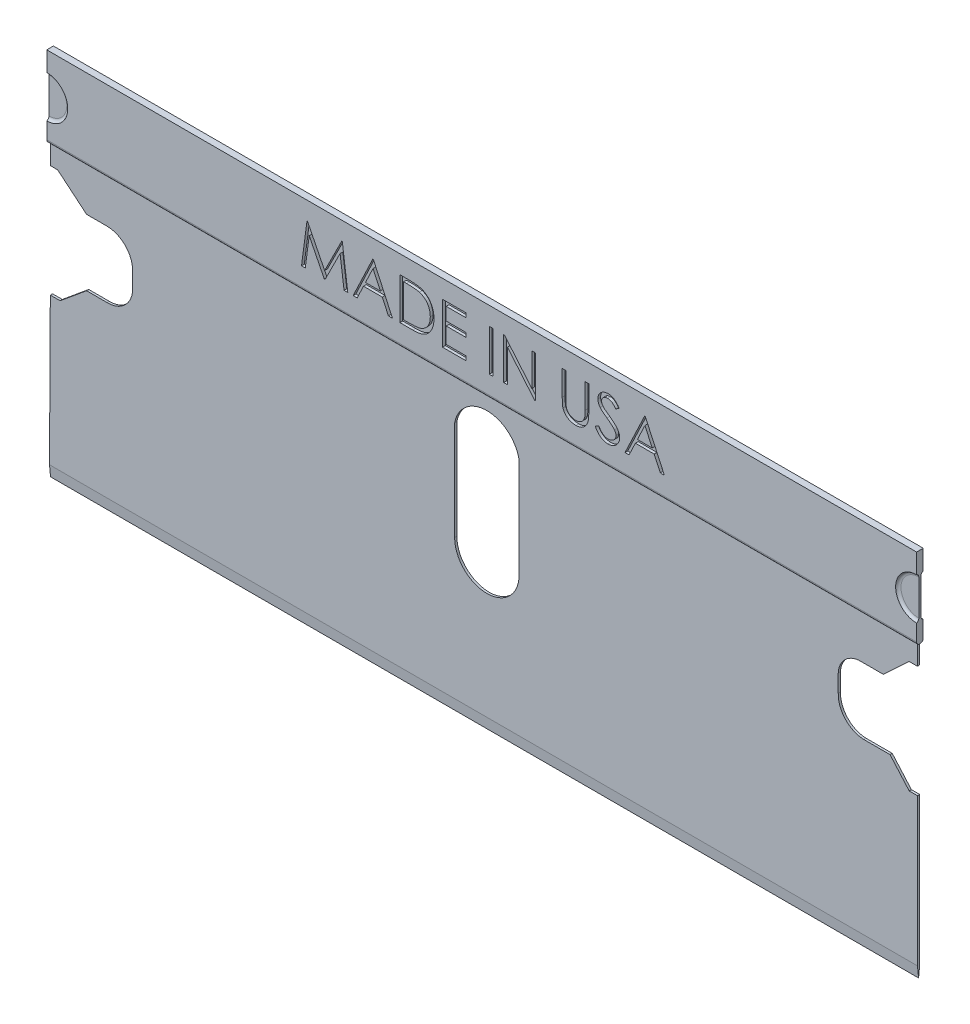
from build123d import *

# Parameters (mm, degrees)
BOSS_EXTRUDE1_DEPTH      = 0.508
BOSS_EXTRUDE1_DEPTH_BACK = 0.508
CHAMFER1_SIZE            = 0.508
CHAMFER1_SIZE2           = 5.08
CHAMFER2_SIZE            = 0.508
CHAMFER2_SIZE_2          = 5.08
BOSS_EXTRUDE2_DEPTH      = 1.016
BOSS_EXTRUDE2_DEPTH_BACK = 2.032
SKETCH2_W                = 399.272431755
SKETCH2_H                = 37.263625027
CUT_EXTRUDE1_DEPTH       = 1.016
FILLET1_R                = 1.524
CUT_EXTRUDE2_DEPTH       = 1.016
FILLET2_R                = 1.524
FILLET3_R                = 1.524
SKETCH5_W                = 1.709615385
SKETCH5_H                = 19.05
CUT_EXTRUDE3_DEPTH       = 1.27


with BuildPart() as part:
    # Sketch1 → Boss-Extrude1 (new, two sides: drawn at the far end of the back side and taken through both)
    with BuildSketch(Plane.XY.offset(-BOSS_EXTRUDE1_DEPTH_BACK)):
        with BuildLine():
            Line((6.643225181, 0), (405.095344745, 0))
            Line((405.095344745, 0), (405.095344745, 72.717463837))
            Line((405.095344745, 72.717463837), (401.301060978, 72.717463837))
            Line((401.301060978, 72.717463837), (392.49166006, 82.756133195))
            Line((392.49166006, 82.756133195), (380.410802322, 82.756133195))
            ThreePointArc((380.410802322, 82.756133195), (371.972618922, 86.601223076), (368.724811349, 95.286808909))
            Line((368.724811349, 95.286808909), (368.724811349, 103.275316273))
            ThreePointArc((368.724811349, 103.275316273), (372.077551467, 110.435017431), (379.51096998, 113.126945398))
            Line((379.51096998, 113.126945398), (389.448720773, 113.126945398))
            Line((389.448720773, 113.126945398), (401.301060978, 124.174896288))
            Line((401.301060978, 124.174896288), (405.095344745, 124.174896288))
            Line((405.095344745, 124.174896288), (405.095344745, 133.946197196))
            Line((405.095344745, 133.946197196), (7.04297701, 133.946197196))
            Line((7.04297701, 133.946197196), (7.04297701, 124.174896288))
            Line((7.04297701, 124.174896288), (10.403963263, 124.174896288))
            Line((10.403963263, 124.174896288), (23.690663617, 113.126945398))
            Line((23.690663617, 113.126945398), (33.017634847, 113.126945398))
            ThreePointArc((33.017634847, 113.126945398), (41.394000015, 109.656176459), (44.860791597, 101.278164368))
            Line((44.860791597, 101.278164368), (44.860791597, 93.928592246))
            ThreePointArc((44.860791597, 93.928592246), (41.253105254, 85.889564647), (33.017634847, 82.756133195))
            Line((33.017634847, 82.756133195), (23.690663617, 82.756133195))
            Line((23.690663617, 82.756133195), (11.539233296, 72.717463837))
            Line((11.539233296, 72.717463837), (7.04297701, 72.717463837))
            Line((7.04297701, 72.717463837), (6.643225181, 0))
        make_face()
        with BuildLine():
            Line((192.64061853, 114.699578164), (192.64061853, 69.101143636))
            ThreePointArc((192.64061853, 69.101143636), (207.448998038, 54.292764127), (222.257377546, 69.101143636))
            Line((222.257377546, 69.101143636), (222.257377546, 114.699578164))
            ThreePointArc((222.257377546, 114.699578164), (207.448998038, 126.994222235), (192.64061853, 114.699578164))
        make_face(mode=Mode.SUBTRACT)
    extrude(amount=BOSS_EXTRUDE1_DEPTH + BOSS_EXTRUDE1_DEPTH_BACK)

    # Chamfer1
    chamfer1_edges = [part.edges().sort_by_distance(p)[0] for p in [
        (205.869284963, 0, 0.508),
    ]]
    chamfer1_side = [part.faces().sort_by_distance(p)[0] for p in [
        (205.869284963, 0, 0),
    ]]
    chamfer(chamfer1_edges, length=CHAMFER1_SIZE, length2=CHAMFER1_SIZE2, reference=chamfer1_side[0])

    # Chamfer2
    # the kernel refuses this chamfer: 5.08, 0.508 mm, written as the material it takes off along each edge
    with BuildSketch(Plane(origin=(-6.562350455, 0, -0.508), x_dir=(0, -0.35748514475784465, 0.9339188247794681), z_dir=(1, 0, 0))) as chamfer2_piece_1:
        Polygon((CHAMFER2_SIZE * 0.933918824779, -CHAMFER2_SIZE * 0.357485144758), (-CHAMFER2_SIZE_2 * 0.357485144758, -CHAMFER2_SIZE_2 * 0.933918824779), (0, 0), align=None)
    extrude(amount=424.863270836, mode=Mode.SUBTRACT)

    # Sketch2 → Boss-Extrude2 (add, two sides: drawn at the far end of the back side and taken through both)
    with BuildSketch(Plane.XY.offset(0.508).offset(-BOSS_EXTRUDE2_DEPTH_BACK)):
        with Locations((206.069160878, 151.771231944)):
            Rectangle(SKETCH2_W, SKETCH2_H)
    extrude(amount=BOSS_EXTRUDE2_DEPTH + BOSS_EXTRUDE2_DEPTH_BACK)

    # Sketch3 → Cut-Extrude1 (cut)
    with BuildSketch(Plane.XY.offset(1.524)):
        with BuildLine():
            Line((405.705376755, 161.390254295), (405.705376755, 142.152209592))
            ThreePointArc((405.705376755, 142.152209592), (396.086354404, 151.771231944), (405.705376755, 161.390254295))
        make_face()
        with BuildLine():
            Line((6.432945, 161.390254295), (6.432945, 142.152209592))
            ThreePointArc((6.432945, 142.152209592), (16.051967351, 151.771231944), (6.432945, 161.390254295))
        make_face()
    extrude(amount=-CUT_EXTRUDE1_DEPTH, mode=Mode.SUBTRACT)

    # Fillet1
    # the kernel refuses this fillet: 1.524 mm, written as the material it adds along each edge
    with BuildSketch(Plane(origin=(6.432945, 151.771231944, 0.508), x_dir=(0, -1, 0), z_dir=(-1, 0, 0))) as fillet1_piece_1:
        with BuildLine():
            CenterArc((8.182181372, 1.524), FILLET1_R, 270, 70.528779366)
            Line((8.182181372, 0), (8.182181372, -0.03048))
            Line((8.182181372, -0.03048), (9.619022351, -0.03048))
            Line((9.619022351, -0.03048), (9.649502351, 0))
            ThreePointArc((9.649502351, 0), (9.649502351, 0.508), (9.647759171, 1.00584))
            Line((9.647759171, 1.00584), (9.619022351, 1.016))
        make_face()
    revolve(axis=Axis((6.432945, 151.771231944, 0.508), (0, 0, 1)), revolution_arc=180)
    with BuildSketch(Plane(origin=(405.705376755, 151.771231944, 0.508), x_dir=(0, -1, 0), z_dir=(1, 0, 0))) as fillet1_piece_2:
        with BuildLine():
            CenterArc((8.182181372, -1.524), FILLET1_R, 19.471220634, 70.528779366)
            Line((8.182181372, 0), (8.182181372, 0.03048))
            Line((8.182181372, 0.03048), (9.619022351, 0.03048))
            Line((9.619022351, 0.03048), (9.649502351, 0))
            ThreePointArc((9.649502351, 0), (9.649502351, -0.508), (9.647759171, -1.00584))
            Line((9.647759171, -1.00584), (9.619022351, -1.016))
        make_face()
    revolve(axis=Axis((405.705376755, 151.771231944, 0.508), (0, 0, -1)), revolution_arc=180)

    # Sketch4 → Cut-Extrude2 (cut)
    with BuildSketch(Plane(origin=(0, 0, -1.524), x_dir=(-1, 0, 0), z_dir=(0, 0, -1))):
        with BuildLine():
            ThreePointArc((-405.705376755, 142.152209592), (-396.086354404, 151.771231944), (-405.705376755, 161.390254295))
            Line((-405.705376755, 161.390254295), (-405.705376755, 142.152209592))
        make_face()
        with BuildLine():
            Line((-6.432945, 142.152209592), (-6.432945, 161.390254295))
            ThreePointArc((-6.432945, 161.390254295), (-16.051967351, 151.771231944), (-6.432945, 142.152209592))
        make_face()
    extrude(amount=-CUT_EXTRUDE2_DEPTH, mode=Mode.SUBTRACT)

    # Fillet2
    # the kernel refuses this fillet: 1.524 mm, written as the material it adds along each edge
    with BuildSketch(Plane(origin=(6.432945, 151.771231944, -0.508), x_dir=(0, 1, 0), z_dir=(-1, 0, 0))) as fillet2_piece_1:
        with BuildLine():
            CenterArc((8.182181372, 1.524), FILLET2_R, 270, 70.528779366)
            Line((8.182181372, 0), (8.182181372, -0.03048))
            Line((8.182181372, -0.03048), (9.619022351, -0.03048))
            Line((9.619022351, -0.03048), (9.649502351, 0))
            ThreePointArc((9.649502351, 0), (9.649502351, 0.508), (9.647759171, 1.00584))
            Line((9.647759171, 1.00584), (9.619022351, 1.016))
        make_face()
    revolve(axis=Axis((6.432945, 151.771231944, -0.508), (0, 0, -1)), revolution_arc=180)
    with BuildSketch(Plane(origin=(405.705376755, 151.771231944, -0.508), x_dir=(0, -1, 0), z_dir=(1, 0, 0))) as fillet2_piece_2:
        with BuildLine():
            CenterArc((8.182181372, 1.524), FILLET2_R, 270, 70.528779366)
            Line((8.182181372, 0), (8.182181372, -0.03048))
            Line((8.182181372, -0.03048), (9.619022351, -0.03048))
            Line((9.619022351, -0.03048), (9.649502351, 0))
            ThreePointArc((9.649502351, 0), (9.649502351, 0.508), (9.647759171, 1.00584))
            Line((9.647759171, 1.00584), (9.619022351, 1.016))
        make_face()
    revolve(axis=Axis((405.705376755, 151.771231944, -0.508), (0, 0, -1)), revolution_arc=180)

    # Fillet3
    # the kernel refuses this fillet: 1.524 mm, written as the material it takes off along each edge
    with BuildSketch(Plane(origin=(2.622945, 133.13941943, 1.524), x_dir=(0, 0, -1), z_dir=(1, 0, 0))) as fillet3_piece_1_section:
        with BuildLine():
            CenterArc((FILLET3_R, FILLET3_R), FILLET3_R, 180, 90)
            Line((0, FILLET3_R), (0, 0))
            Line((0, 0), (FILLET3_R, 0))
        make_face()
    fillet3_piece_1 = extrude(amount=406.892431756, mode=Mode.PRIVATE)
    fillet3_piece_1 = split(fillet3_piece_1, bisect_by=Plane(origin=(7.04297701, 133.144190608, 0.315961517), z_dir=(-1, 0, 0)), keep=Keep.TOP, mode=Mode.PRIVATE)
    fillet3_piece_1 = split(fillet3_piece_1, bisect_by=Plane(origin=(4.832961005, 133.144190608, 0.508), z_dir=(0, 0, -1)), keep=Keep.TOP, mode=Mode.PRIVATE)
    add(fillet3_piece_1, mode=Mode.SUBTRACT)
    with BuildSketch(Plane(origin=(2.622945, 133.13941943, 1.524), x_dir=(0, 0, -1), z_dir=(1, 0, 0))) as fillet3_piece_2_section:
        with BuildLine():
            CenterArc((FILLET3_R, FILLET3_R), FILLET3_R, 180, 90)
            Line((0, FILLET3_R), (0, 0))
            Line((0, 0), (FILLET3_R, 0))
        make_face()
    fillet3_piece_2 = extrude(amount=406.892431756, mode=Mode.PRIVATE)
    fillet3_piece_2 = split(fillet3_piece_2, bisect_by=Plane(origin=(7.04297701, 133.502644665, 1.225133438), z_dir=(-1, 0, 0)), keep=Keep.TOP, mode=Mode.PRIVATE)
    fillet3_piece_2 = split(fillet3_piece_2, bisect_by=Plane(origin=(4.832961005, 133.502644665, 0.508), z_dir=(0, 0, 1)), keep=Keep.TOP, mode=Mode.PRIVATE)
    add(fillet3_piece_2, mode=Mode.SUBTRACT)
    with BuildSketch(Plane(origin=(2.622945, 133.13941943, 1.524), x_dir=(0, 0, -1), z_dir=(1, 0, 0))) as fillet3_piece_3_section:
        with BuildLine():
            CenterArc((FILLET3_R, FILLET3_R), FILLET3_R, 180, 90)
            Line((0, FILLET3_R), (0, 0))
            Line((0, 0), (FILLET3_R, 0))
        make_face()
    fillet3_piece_3 = extrude(amount=406.892431756, mode=Mode.PRIVATE)
    fillet3_piece_3 = split(fillet3_piece_3, bisect_by=Plane(origin=(405.095344745, 133.502644665, 1.225133438), z_dir=(-1, 0, 0)), keep=Keep.TOP, mode=Mode.PRIVATE)
    fillet3_piece_3 = split(fillet3_piece_3, bisect_by=Plane(origin=(7.04297701, 133.502644665, 1.225133438), z_dir=(1, 0, 0)), keep=Keep.TOP, mode=Mode.PRIVATE)
    fillet3_piece_3 = split(fillet3_piece_3, bisect_by=Plane(origin=(206.069160877, 133.502644665, 0.508), z_dir=(0, 0, 1)), keep=Keep.TOP, mode=Mode.PRIVATE)
    add(fillet3_piece_3, mode=Mode.SUBTRACT)
    with BuildSketch(Plane(origin=(2.622945, 133.13941943, 1.524), x_dir=(0, 0, -1), z_dir=(1, 0, 0))) as fillet3_piece_4_section:
        with BuildLine():
            CenterArc((FILLET3_R, FILLET3_R), FILLET3_R, 180, 90)
            Line((0, FILLET3_R), (0, 0))
            Line((0, 0), (FILLET3_R, 0))
        make_face()
    fillet3_piece_4 = extrude(amount=406.892431756, mode=Mode.PRIVATE)
    fillet3_piece_4 = split(fillet3_piece_4, bisect_by=Plane(origin=(405.095344745, 133.144190608, 0.315961517), z_dir=(1, 0, 0)), keep=Keep.TOP, mode=Mode.PRIVATE)
    fillet3_piece_4 = split(fillet3_piece_4, bisect_by=Plane(origin=(407.30536075, 133.144190608, 0.508), z_dir=(0, 0, -1)), keep=Keep.TOP, mode=Mode.PRIVATE)
    add(fillet3_piece_4, mode=Mode.SUBTRACT)
    with BuildSketch(Plane(origin=(2.622945, 133.13941943, 1.524), x_dir=(0, 0, -1), z_dir=(1, 0, 0))) as fillet3_piece_5_section:
        with BuildLine():
            CenterArc((FILLET3_R, FILLET3_R), FILLET3_R, 180, 90)
            Line((0, FILLET3_R), (0, 0))
            Line((0, 0), (FILLET3_R, 0))
        make_face()
    fillet3_piece_5 = extrude(amount=406.892431756, mode=Mode.PRIVATE)
    fillet3_piece_5 = split(fillet3_piece_5, bisect_by=Plane(origin=(405.095344745, 133.502644665, 1.225133438), z_dir=(1, 0, 0)), keep=Keep.TOP, mode=Mode.PRIVATE)
    fillet3_piece_5 = split(fillet3_piece_5, bisect_by=Plane(origin=(407.30536075, 133.502644665, 0.508), z_dir=(0, 0, 1)), keep=Keep.TOP, mode=Mode.PRIVATE)
    add(fillet3_piece_5, mode=Mode.SUBTRACT)
    with BuildSketch(Plane(origin=(2.622945, 133.13941943, -1.524), x_dir=(0, 1, 0), z_dir=(1, 0, 0))) as fillet3_piece_6_section:
        with BuildLine():
            CenterArc((FILLET3_R, FILLET3_R), FILLET3_R, 180, 90)
            Line((0, FILLET3_R), (0, 0))
            Line((0, 0), (FILLET3_R, 0))
        make_face()
    fillet3_piece_6 = extrude(amount=406.892431756, mode=Mode.PRIVATE)
    fillet3_piece_6 = split(fillet3_piece_6, bisect_by=Plane(origin=(4.832961005, 133.502644665, -0.508), z_dir=(0, 0, -1)), keep=Keep.TOP, mode=Mode.PRIVATE)
    fillet3_piece_6 = split(fillet3_piece_6, bisect_by=Plane(origin=(7.04297701, 133.502644665, -1.225133438), z_dir=(-1, 0, 0)), keep=Keep.TOP, mode=Mode.PRIVATE)
    add(fillet3_piece_6, mode=Mode.SUBTRACT)
    with BuildSketch(Plane(origin=(2.622945, 133.13941943, -1.524), x_dir=(0, 1, 0), z_dir=(1, 0, 0))) as fillet3_piece_7_section:
        with BuildLine():
            CenterArc((FILLET3_R, FILLET3_R), FILLET3_R, 180, 90)
            Line((0, FILLET3_R), (0, 0))
            Line((0, 0), (FILLET3_R, 0))
        make_face()
    fillet3_piece_7 = extrude(amount=406.892431756, mode=Mode.PRIVATE)
    fillet3_piece_7 = split(fillet3_piece_7, bisect_by=Plane(origin=(4.832961005, 133.144190608, -0.508), z_dir=(0, 0, 1)), keep=Keep.TOP, mode=Mode.PRIVATE)
    fillet3_piece_7 = split(fillet3_piece_7, bisect_by=Plane(origin=(7.04297701, 133.144190608, -0.315961517), z_dir=(-1, 0, 0)), keep=Keep.TOP, mode=Mode.PRIVATE)
    add(fillet3_piece_7, mode=Mode.SUBTRACT)
    with BuildSketch(Plane(origin=(2.622945, 133.13941943, -1.524), x_dir=(0, 1, 0), z_dir=(1, 0, 0))) as fillet3_piece_8_section:
        with BuildLine():
            CenterArc((FILLET3_R, FILLET3_R), FILLET3_R, 180, 90)
            Line((0, FILLET3_R), (0, 0))
            Line((0, 0), (FILLET3_R, 0))
        make_face()
    fillet3_piece_8 = extrude(amount=406.892431756, mode=Mode.PRIVATE)
    fillet3_piece_8 = split(fillet3_piece_8, bisect_by=Plane(origin=(405.095344745, 133.502644665, -1.225133438), z_dir=(-1, 0, 0)), keep=Keep.TOP, mode=Mode.PRIVATE)
    fillet3_piece_8 = split(fillet3_piece_8, bisect_by=Plane(origin=(206.069160877, 133.502644665, -0.508), z_dir=(0, 0, -1)), keep=Keep.TOP, mode=Mode.PRIVATE)
    fillet3_piece_8 = split(fillet3_piece_8, bisect_by=Plane(origin=(7.04297701, 133.502644665, -1.225133438), z_dir=(1, 0, 0)), keep=Keep.TOP, mode=Mode.PRIVATE)
    add(fillet3_piece_8, mode=Mode.SUBTRACT)
    with BuildSketch(Plane(origin=(2.622945, 133.13941943, -1.524), x_dir=(0, 1, 0), z_dir=(1, 0, 0))) as fillet3_piece_9_section:
        with BuildLine():
            CenterArc((FILLET3_R, FILLET3_R), FILLET3_R, 180, 90)
            Line((0, FILLET3_R), (0, 0))
            Line((0, 0), (FILLET3_R, 0))
        make_face()
    fillet3_piece_9 = extrude(amount=406.892431756, mode=Mode.PRIVATE)
    fillet3_piece_9 = split(fillet3_piece_9, bisect_by=Plane(origin=(405.095344745, 133.502644665, -1.225133438), z_dir=(1, 0, 0)), keep=Keep.TOP, mode=Mode.PRIVATE)
    fillet3_piece_9 = split(fillet3_piece_9, bisect_by=Plane(origin=(407.30536075, 133.502644665, -0.508), z_dir=(0, 0, -1)), keep=Keep.TOP, mode=Mode.PRIVATE)
    add(fillet3_piece_9, mode=Mode.SUBTRACT)
    with BuildSketch(Plane(origin=(2.622945, 133.13941943, -1.524), x_dir=(0, 1, 0), z_dir=(1, 0, 0))) as fillet3_piece_10_section:
        with BuildLine():
            CenterArc((FILLET3_R, FILLET3_R), FILLET3_R, 180, 90)
            Line((0, FILLET3_R), (0, 0))
            Line((0, 0), (FILLET3_R, 0))
        make_face()
    fillet3_piece_10 = extrude(amount=406.892431756, mode=Mode.PRIVATE)
    fillet3_piece_10 = split(fillet3_piece_10, bisect_by=Plane(origin=(405.095344745, 133.144190608, -0.315961517), z_dir=(1, 0, 0)), keep=Keep.TOP, mode=Mode.PRIVATE)
    fillet3_piece_10 = split(fillet3_piece_10, bisect_by=Plane(origin=(407.30536075, 133.144190608, -0.508), z_dir=(0, 0, 1)), keep=Keep.TOP, mode=Mode.PRIVATE)
    add(fillet3_piece_10, mode=Mode.SUBTRACT)

    # Sketch5 → Cut-Extrude3 (cut)
    # profile 1 of 9: a face of its own
    with BuildSketch(Plane.XY.offset(1.524)):
        Polygon((123.365110877, 143.022992377), (125.879924579, 162.072992377), (126.124155348, 162.072992377), (133.989149338, 146.442223146), (141.8350628, 162.072992377), (142.083109675, 162.072992377), (144.6131878, 143.022992377), (142.895940204, 143.022992377), (141.071841646, 156.7304443), (134.19521905, 143.022992377), (133.809792367, 143.022992377), (126.906457031, 156.760973146), (125.086174579, 143.022992377), align=None)
    # profile 2 of 9: a face of its own
    with BuildSketch(Plane.XY.offset(1.524)):
        Polygon((156.336264723, 162.072992377), (165.128572415, 143.022992377), (163.270128906, 143.022992377), (160.453842848, 149.128761608), (151.817995492, 149.128761608), (148.921571213, 143.022992377), (147.055495492, 143.022992377), (156.092033954, 162.072992377), align=None)
        Polygon((156.195068809, 158.359921464), (152.745309194, 151.082607762), (159.553241886, 151.082607762), align=None, mode=Mode.SUBTRACT)
    # profile 3 of 9: a face of its own
    with BuildSketch(Plane.XY.offset(1.524)):
        with BuildLine():
            Line((168.547803184, 143.022992377), (168.547803184, 162.072992377))
            Line((168.547803184, 162.072992377), (172.3944378, 162.072992377))
            add(Edge.make_bspline(
                [(172.3944378, 162.072992377), (172.729004721, 162.070583532), (173.375386273, 162.065929655), (174.309448308, 162.036421798), (175.173685644, 161.984222262), (175.96525592, 161.908188127), (176.686332231, 161.814826616), (177.334895512, 161.697802986), (177.914299318, 161.559618802), (178.270640131, 161.441805708), (178.439149338, 161.386093339)],
                knots=[0, 0, 0, 0, 1.314313732, 2.53924729, 3.670748893, 4.714932338, 5.66265055, 6.526160246, 7.303039223, 8, 8, 8, 8], degree=3))
            add(Edge.make_bspline(
                [(178.439149338, 161.386093339), (178.659556419, 161.302106212), (179.09537248, 161.136036509), (179.715896962, 160.822765783), (180.30005358, 160.467820186), (180.850974926, 160.070731848), (181.356076567, 159.620257323), (181.835090976, 159.135532328), (182.268422544, 158.598930076), (182.665251984, 158.02157907), (183.023041787, 157.410280615), (183.334042061, 156.766199523), (183.592327368, 156.092606719), (183.806739072, 155.391375414), (183.975720506, 154.6609637), (184.091010734, 153.900521086), (184.167052836, 153.113052927), (184.174694887, 152.578703346), (184.178572415, 152.307577714)],
                knots=[0, 0, 0, 0, 0.984719456, 1.947108742, 2.898477687, 3.838006223, 4.779231079, 5.722358779, 6.681677486, 7.655904652, 8.64651281, 9.637519902, 10.640069247, 11.656948941, 12.698408672, 13.768548281, 14.867775369, 16, 16, 16, 16], degree=3))
            add(Edge.make_bspline(
                [(184.178572415, 152.307577714), (184.175149035, 152.072112973), (184.168402907, 151.608105107), (184.107827631, 150.924259661), (184.019782231, 150.260701508), (183.88347024, 149.620590484), (183.717993703, 148.998318327), (183.505917394, 148.400517111), (183.262972765, 147.821702949), (182.979672711, 147.269702116), (182.668660316, 146.746734046), (182.334894828, 146.253744386), (181.978732243, 145.797767822), (181.596776298, 145.377423519), (181.19396287, 144.993345156), (180.767654728, 144.64232433), (180.316751837, 144.331229367), (179.84327376, 144.047835535), (179.333407972, 143.800619029), (178.777497043, 143.591449976), (178.173170202, 143.418113398), (177.521910808, 143.273491808), (176.822593594, 143.15877106), (176.074532937, 143.081883124), (175.278878175, 143.029887876), (174.732528174, 143.025335507), (174.451318809, 143.022992377)],
                knots=[0, 0, 0, 0, 1.105936401, 2.179363191, 3.223086493, 4.248585256, 5.251745608, 6.245858792, 7.225916811, 8.198733463, 9.158002045, 10.082870192, 10.993790845, 11.873723703, 12.748670949, 13.606408763, 14.465103618, 15.319838547, 16.196477973, 17.123216899, 18.106603292, 19.147568657, 20.255746949, 21.433717677, 22.679120308, 24, 24, 24, 24], degree=3))
            Line((174.451318809, 143.022992377), (168.547803184, 143.022992377))
        make_face()
        with BuildLine():
            Line((170.257418569, 144.976838531), (172.444047175, 144.976838531))
            add(Edge.make_bspline(
                [(172.444047175, 144.976838531), (172.75825445, 144.978188884), (173.36259011, 144.980786108), (174.231585781, 145.003576456), (175.025586496, 145.040816145), (175.744704997, 145.092931925), (176.388535258, 145.161885388), (176.958422811, 145.238765216), (177.452499574, 145.334545626), (177.751472652, 145.42136442), (177.889630108, 145.461483964)],
                knots=[0, 0, 0, 0, 1.375205317, 2.645023457, 3.804390687, 4.853969522, 5.800190428, 6.637939096, 7.370582563, 8, 8, 8, 8], degree=3))
            add(Edge.make_bspline(
                [(177.889630108, 145.461483964), (178.063520478, 145.522724588), (178.407147852, 145.643743105), (178.901800616, 145.864492661), (179.363120884, 146.125978783), (179.799148307, 146.416639732), (180.203697675, 146.746727257), (180.581563222, 147.109063639), (180.931984169, 147.505492915), (181.251340046, 147.935523051), (181.537135243, 148.39647751), (181.784628649, 148.883824591), (182.001534842, 149.392224515), (182.171779754, 149.929484364), (182.305214576, 150.490801096), (182.399728092, 151.0762142), (182.458591092, 151.685614348), (182.465456973, 152.100099482), (182.468957031, 152.311393819)],
                knots=[0, 0, 0, 0, 0.998632004, 1.973411704, 2.929992603, 3.868527914, 4.809262121, 5.754881198, 6.702106254, 7.672490631, 8.653608572, 9.636854334, 10.631411391, 11.644891563, 12.686317036, 13.754757253, 14.855430412, 16, 16, 16, 16], degree=3))
            add(Edge.make_bspline(
                [(182.468957031, 152.311393819), (182.466163281, 152.534188905), (182.460674935, 152.971871823), (182.391690474, 153.614078321), (182.290880293, 154.231737291), (182.145100516, 154.82489004), (181.959331018, 155.394693785), (181.727494468, 155.937997119), (181.462609012, 156.460537906), (181.147449421, 156.950255525), (180.802287406, 157.413405162), (180.419230663, 157.837702631), (180.004364996, 158.224114465), (179.562215315, 158.578658438), (179.080320532, 158.887070731), (178.570032587, 159.162951096), (178.023865434, 159.397080447), (177.643884903, 159.521606829), (177.450777944, 159.584891416)],
                knots=[0, 0, 0, 0, 1.122418816, 2.205001699, 3.251619955, 4.274784885, 5.280384055, 6.268708349, 7.249350384, 8.229342522, 9.199999885, 10.157847722, 11.105861043, 12.055065948, 13.010012805, 13.98527497, 14.976112212, 16, 16, 16, 16], degree=3))
            add(Edge.make_bspline(
                [(177.450777944, 159.584891416), (177.291023847, 159.629067973), (176.951342806, 159.722999455), (176.397045152, 159.825463268), (175.773211267, 159.915839184), (175.077071465, 159.992355084), (174.309419281, 160.047258933), (173.469664322, 160.088468517), (172.557443617, 160.116263188), (171.925078683, 160.118161151), (171.596871694, 160.119146223)],
                knots=[0, 0, 0, 0, 0.674548936, 1.434276114, 2.292660221, 3.240891867, 4.284742987, 5.42552168, 6.663806718, 8, 8, 8, 8], degree=3))
            Line((171.596871694, 160.119146223), (170.257418569, 160.119146223))
            Line((170.257418569, 160.119146223), (170.257418569, 144.976838531))
        make_face(mode=Mode.SUBTRACT)
    # profile 4 of 9: a face of its own
    with BuildSketch(Plane.XY.offset(1.524)):
        Polygon((188.086264723, 162.072992377), (198.832418569, 162.072992377), (198.832418569, 160.119146223), (189.795880108, 160.119146223), (189.795880108, 154.257607762), (198.832418569, 154.257607762), (198.832418569, 152.303761608), (189.795880108, 152.303761608), (189.795880108, 144.976838531), (198.832418569, 144.976838531), (198.832418569, 143.022992377), (188.086264723, 143.022992377), align=None)
    # profile 5 of 9: a face of its own
    with BuildSketch(Plane.XY.offset(1.524)):
        with Locations((210.433380107, 152.547992377)):
            Rectangle(SKETCH5_W, SKETCH5_H)
    # profile 6 of 9: a face of its own
    with BuildSketch(Plane.XY.offset(1.524)):
        Polygon((216.172803184, 143.022992377), (216.172803184, 162.072992377), (216.531517127, 162.072992377), (229.117033954, 147.07951281), (229.117033954, 162.072992377), (230.826649338, 162.072992377), (230.826649338, 143.022992377), (230.43740655, 143.022992377), (217.882418569, 157.982126992), (217.882418569, 143.022992377), align=None)
    # profile 7 of 9: a face of its own
    with BuildSketch(Plane.XY.offset(1.524)):
        with BuildLine():
            Line((243.0381878, 162.072992377), (244.747803184, 162.072992377))
            Line((244.747803184, 162.072992377), (244.747803184, 150.659020021))
            add(Edge.make_bspline(
                [(244.747803184, 150.659020021), (244.747548764, 150.497472017), (244.747065956, 150.190906839), (244.750290925, 149.754562231), (244.75932263, 149.366636419), (244.765016727, 149.025634084), (244.777684071, 148.733119987), (244.788014869, 148.487509368), (244.801298471, 148.289965208), (244.81726301, 148.174680454), (244.8241253, 148.125125791)],
                knots=[0, 0, 0, 0, 1.528628734, 2.90083645, 4.128790002, 5.200304208, 6.127813768, 6.898992206, 7.526736466, 8, 8, 8, 8], degree=3))
            add(Edge.make_bspline(
                [(244.8241253, 148.125125791), (244.852305468, 147.94634555), (244.907077954, 147.598858696), (245.046667525, 147.104057905), (245.241617066, 146.658116682), (245.472628484, 146.247119511), (245.777061697, 145.882505995), (246.141752368, 145.546618284), (246.583591365, 145.252857462), (247.074866947, 144.984248043), (247.604376597, 144.768356667), (248.145457918, 144.605107069), (248.689977562, 144.505617629), (249.054519261, 144.49409761), (249.235543569, 144.488376992)],
                knots=[0, 0, 0, 0, 1.035780045, 2.013197591, 2.933192213, 3.817615948, 4.702609284, 5.640816605, 6.646850145, 7.73207398, 8.84249596, 9.914020372, 10.964143139, 12, 12, 12, 12], degree=3))
            add(Edge.make_bspline(
                [(249.235543569, 144.488376992), (249.390957499, 144.494221806), (249.700887729, 144.505877675), (250.161388444, 144.57805775), (250.609880464, 144.708145115), (251.048578451, 144.876001514), (251.459791666, 145.097784831), (251.843749543, 145.353984686), (252.186453242, 145.654489597), (252.499188916, 145.987050044), (252.771521924, 146.362279526), (253.007584852, 146.772007678), (253.200947412, 147.222400551), (253.296434311, 147.538926764), (253.345489483, 147.70153805)],
                knots=[0, 0, 0, 0, 0.994687771, 1.983630487, 2.973142513, 3.978332533, 4.983357753, 5.956394766, 6.925816176, 7.893390482, 8.871859704, 9.88551698, 10.913711441, 12, 12, 12, 12], degree=3))
            add(Edge.make_bspline(
                [(253.345489483, 147.70153805), (253.361818736, 147.768749576), (253.398206893, 147.918523942), (253.432208667, 148.171732681), (253.467622755, 148.470487648), (253.492194914, 148.816935372), (253.516150128, 149.209914951), (253.530481567, 149.651473581), (253.537105704, 150.140007896), (253.539079721, 150.48093302), (253.540110877, 150.659020021)],
                knots=[0, 0, 0, 0, 0.558680831, 1.244966039, 2.062412453, 2.990489873, 4.051219941, 5.244515665, 6.560634259, 8, 8, 8, 8], degree=3))
            Line((253.540110877, 150.659020021), (253.540110877, 162.072992377))
            Line((253.540110877, 162.072992377), (255.249726261, 162.072992377))
            Line((255.249726261, 162.072992377), (255.249726261, 150.567433483))
            add(Edge.make_bspline(
                [(255.249726261, 150.567433483), (255.24834312, 150.360069449), (255.245643837, 149.955385929), (255.222236413, 149.362379246), (255.184914743, 148.799843734), (255.132183864, 148.267703774), (255.062313889, 147.767863564), (254.984615903, 147.295941898), (254.885667302, 146.855326323), (254.770096933, 146.442581307), (254.637979479, 146.04968587), (254.4668498, 145.676803267), (254.274039307, 145.312597749), (254.045359554, 144.962577899), (253.788394742, 144.625193946), (253.49746488, 144.302491981), (253.182191947, 143.989315172), (252.837334916, 143.693696911), (252.468578485, 143.422595399), (252.077019573, 143.184210388), (251.665666012, 142.982696127), (251.235587082, 142.816820024), (250.78659925, 142.692099134), (250.318691192, 142.5991615), (249.830797868, 142.546353281), (249.498975954, 142.538505062), (249.330946213, 142.534530839)],
                knots=[0, 0, 0, 0, 1.316592851, 2.569410997, 3.76748051, 4.895814652, 5.963796859, 6.97159953, 7.931736103, 8.829262218, 9.692595152, 10.560224239, 11.431080259, 12.30701507, 13.211635791, 14.121146779, 15.063487852, 16.031507147, 17.00238618, 17.966455255, 18.938106653, 19.907068911, 20.888905087, 21.893141452, 22.933117798, 24, 24, 24, 24], degree=3))
            add(Edge.make_bspline(
                [(249.330946213, 142.534530839), (249.147690098, 142.538802204), (248.788142254, 142.547182607), (248.25834506, 142.595203576), (247.75044922, 142.685655122), (247.259090518, 142.800825673), (246.790958555, 142.959668586), (246.339781379, 143.145259808), (245.913286272, 143.373191753), (245.504554214, 143.626792935), (245.124508042, 143.912132752), (244.775635033, 144.223138556), (244.457359223, 144.554828324), (244.175045319, 144.910793172), (243.924015933, 145.288264606), (243.707770057, 145.688310468), (243.522096543, 146.110775875), (243.426266513, 146.404435437), (243.377821213, 146.552890214)],
                knots=[0, 0, 0, 0, 1.13879206, 2.234305948, 3.301075583, 4.341971843, 5.366689343, 6.369221514, 7.369726634, 8.367512178, 9.355451585, 10.318319045, 11.268648973, 12.207971039, 13.137398894, 14.081662264, 15.030215811, 16, 16, 16, 16], degree=3))
            add(Edge.make_bspline(
                [(243.377821213, 146.552890214), (243.349642681, 146.654304655), (243.288522817, 146.874274835), (243.22307084, 147.238328437), (243.168048552, 147.657509632), (243.116311157, 148.131847112), (243.0857824, 148.661708529), (243.059017484, 149.2468642), (243.037999244, 149.888021677), (243.038123191, 150.334632683), (243.0381878, 150.567433483)],
                knots=[0, 0, 0, 0, 0.625038921, 1.35572334, 2.194682327, 3.136881307, 4.189498639, 5.346923369, 6.617055217, 8, 8, 8, 8], degree=3))
            Line((243.0381878, 150.567433483), (243.0381878, 162.072992377))
        make_face()
    # profile 8 of 9: a face of its own
    with BuildSketch(Plane.XY.offset(1.524)):
        with BuildLine():
            Line((258.180495492, 146.697902233), (259.790892127, 147.663376992))
            add(Edge.make_bspline(
                [(259.790892127, 147.663376992), (259.940669961, 147.412655126), (260.227638511, 146.932281705), (260.706345195, 146.283177228), (261.202368611, 145.731477489), (261.719381984, 145.280391953), (262.254229501, 144.925251584), (262.810402708, 144.673779437), (263.386027364, 144.5169382), (263.777770592, 144.497887729), (263.97334405, 144.488376992)],
                knots=[0, 0, 0, 0, 1.272034388, 2.437168799, 3.508375237, 4.49857839, 5.41946034, 6.295179144, 7.148887113, 8, 8, 8, 8], degree=3))
            add(Edge.make_bspline(
                [(263.97334405, 144.488376992), (264.140368248, 144.493028853), (264.471494112, 144.502251177), (264.958968606, 144.590865257), (265.43239813, 144.727002701), (265.882025144, 144.921970914), (266.30164556, 145.157856101), (266.669619145, 145.442768867), (266.987732989, 145.761754072), (267.24795117, 146.117622521), (267.447595362, 146.500348716), (267.601040763, 146.893192108), (267.686194664, 147.302323887), (267.699022136, 147.577789406), (267.705495492, 147.716802473)],
                knots=[0, 0, 0, 0, 1.095163259, 2.171163733, 3.241058638, 4.321873601, 5.38011039, 6.391990106, 7.366004449, 8.327778327, 9.272591725, 10.192022065, 11.087607919, 12, 12, 12, 12], degree=3))
            add(Edge.make_bspline(
                [(267.705495492, 147.716802473), (267.69747103, 147.875411955), (267.68115847, 148.197841855), (267.543282843, 148.67354568), (267.326389085, 149.144312383), (267.126295267, 149.435512128), (267.022412559, 149.5866943)],
                knots=[0, 0, 0, 0, 0.938893495, 1.908633276, 2.914225137, 4, 4, 4, 4], degree=3))
            add(Edge.make_bspline(
                [(267.022412559, 149.5866943), (266.937119645, 149.695806297), (266.75805784, 149.924873287), (266.450223379, 150.265842354), (266.0890021, 150.617551177), (265.686755608, 150.993429758), (265.228831224, 151.375996195), (264.729571468, 151.783493536), (264.176229607, 152.200424977), (263.788156632, 152.480038512), (263.587917367, 152.624314492)],
                knots=[0, 0, 0, 0, 0.722233717, 1.516239348, 2.393582979, 3.351407094, 4.387010283, 5.505090956, 6.712668013, 8, 8, 8, 8], degree=3))
            add(Edge.make_bspline(
                [(263.587917367, 152.624314492), (263.387489616, 152.767072948), (263.00428702, 153.040016244), (262.468391021, 153.44509699), (261.989177587, 153.815450051), (261.568776654, 154.154561888), (261.207373134, 154.462478494), (260.90211914, 154.736242991), (260.660790708, 154.98325923), (260.526593905, 155.143504247), (260.466342848, 155.21545031)],
                knots=[0, 0, 0, 0, 1.452282411, 2.77665338, 3.964542531, 5.026858415, 5.96415736, 6.766646006, 7.446254459, 8, 8, 8, 8], degree=3))
            add(Edge.make_bspline(
                [(260.466342848, 155.21545031), (260.382127995, 155.32757881), (260.216508183, 155.548094555), (259.997890354, 155.89276271), (259.812075767, 156.245586483), (259.666412217, 156.607513974), (259.543750797, 156.973464087), (259.461248346, 157.348211582), (259.409588028, 157.730074919), (259.404297644, 157.987051258), (259.401649338, 158.115690694)],
                knots=[0, 0, 0, 0, 1.068054152, 2.10047183, 3.106115577, 4.101338837, 5.06977816, 6.043150881, 7.020423561, 8, 8, 8, 8], degree=3))
            add(Edge.make_bspline(
                [(259.401649338, 158.115690694), (259.408753404, 158.317238467), (259.422809692, 158.716026071), (259.541684508, 159.298579591), (259.729315543, 159.854765662), (259.992177718, 160.379077907), (260.331035596, 160.857864175), (260.723171543, 161.296631868), (261.190231203, 161.66548658), (261.702690481, 161.987769355), (262.263611592, 162.240023605), (262.851390652, 162.430311225), (263.466961859, 162.538130185), (263.883901777, 162.553602949), (264.095459434, 162.561453916)],
                knots=[0, 0, 0, 0, 1.005424448, 1.989358655, 2.955360095, 3.929531133, 4.905563448, 5.876582895, 6.856512386, 7.866279853, 8.892233794, 9.918561126, 10.94386622, 12, 12, 12, 12], degree=3))
            add(Edge.make_bspline(
                [(264.095459434, 162.561453916), (264.31994518, 162.55371117), (264.766375681, 162.538313322), (265.423052125, 162.404432473), (266.05529831, 162.18290453), (266.563896652, 161.931506263), (266.961947825, 161.680419558), (267.265510841, 161.451711657), (267.573127252, 161.188412852), (267.887278379, 160.889821812), (268.202641111, 160.553198781), (268.52389733, 160.180849175), (268.851798279, 159.775048492), (269.062740889, 159.485355138), (269.170880108, 159.336844541)],
                knots=[0, 0, 0, 0, 1.286793592, 2.559021753, 3.825965368, 5.121522368, 5.803751409, 6.523245864, 7.299691795, 8.125521123, 9.008227632, 9.944561021, 10.946284179, 12, 12, 12, 12], degree=3))
            Line((269.170880108, 159.336844541), (267.625357271, 158.165300069))
            add(Edge.make_bspline(
                [(267.625357271, 158.165300069), (267.53203441, 158.285525656), (267.352316399, 158.517052026), (267.079468764, 158.841290186), (266.822301123, 159.137471311), (266.568933947, 159.39472865), (266.33274861, 159.627150262), (266.103511566, 159.826139795), (265.88452174, 159.993646965), (265.60847684, 160.17240977), (265.261670402, 160.349610167), (264.826325998, 160.499555864), (264.371377843, 160.589662701), (264.061517992, 160.601576503), (263.904654146, 160.607607762)],
                knots=[0, 0, 0, 0, 1.181633172, 2.275549214, 3.290209073, 4.226197932, 5.078386478, 5.862611352, 6.581680152, 7.217281963, 8.414376989, 9.595101626, 10.782541182, 12, 12, 12, 12], degree=3))
            add(Edge.make_bspline(
                [(263.904654146, 160.607607762), (263.70785936, 160.601012652), (263.328359153, 160.588294604), (262.789569439, 160.44939297), (262.304643933, 160.230688845), (261.887979257, 159.924174464), (261.541067997, 159.561021632), (261.290122571, 159.143125292), (261.13908239, 158.681666787), (261.120651353, 158.3597672), (261.111264723, 158.195828916)],
                knots=[0, 0, 0, 0, 1.14458467, 2.207223713, 3.21896685, 4.227309161, 5.202851033, 6.127160689, 7.046193047, 8, 8, 8, 8], degree=3))
            add(Edge.make_bspline(
                [(261.111264723, 158.195828916), (261.113404455, 158.093767297), (261.117687418, 157.889477168), (261.177421674, 157.587663), (261.254162307, 157.286611281), (261.37577006, 156.987675509), (261.543656641, 156.68562764), (261.764120527, 156.375266469), (262.041778697, 156.053856454), (262.254469293, 155.844810606), (262.366763521, 155.734440694)],
                knots=[0, 0, 0, 0, 0.858281714, 1.717966888, 2.583508476, 3.4729293, 4.427298488, 5.488583878, 6.674047936, 8, 8, 8, 8], degree=3))
            add(Edge.make_bspline(
                [(262.366763521, 155.734440694), (262.408463277, 155.69722774), (262.50753235, 155.608818277), (262.688648461, 155.464080292), (262.927822834, 155.285539489), (263.218809957, 155.064628524), (263.566975169, 154.808370851), (263.972356753, 154.520043048), (264.430435953, 154.19028505), (264.75549381, 153.959739007), (264.927370492, 153.837836127)],
                knots=[0, 0, 0, 0, 0.420754252, 0.999615792, 1.744751191, 2.668019286, 3.750313428, 4.999500688, 6.413464383, 8, 8, 8, 8], degree=3))
            add(Edge.make_bspline(
                [(264.927370492, 153.837836127), (265.134122392, 153.687388156), (265.53446879, 153.396066511), (266.104105046, 152.958375453), (266.620598488, 152.530306884), (267.085762496, 152.114594479), (267.504192526, 151.714391573), (267.871246405, 151.324883406), (268.19066418, 150.948860503), (268.53453964, 150.466772627), (268.88591863, 149.874692725), (269.187678834, 149.149278313), (269.377952125, 148.421044054), (269.402834231, 147.93158513), (269.415110877, 147.690089733)],
                knots=[0, 0, 0, 0, 1.163667725, 2.253281268, 3.268753668, 4.215851969, 5.092017293, 5.902905408, 6.650798638, 7.335211899, 8.59617414, 9.77448103, 10.901945474, 12, 12, 12, 12], degree=3))
            add(Edge.make_bspline(
                [(269.415110877, 147.690089733), (269.411534168, 147.519301774), (269.404450207, 147.181042444), (269.323020091, 146.684354097), (269.203714485, 146.201948935), (269.02389754, 145.73978988), (268.80442435, 145.289421957), (268.525933772, 144.862658956), (268.203130517, 144.450055558), (267.832832454, 144.062613984), (267.427634042, 143.706943974), (266.999369933, 143.390555797), (266.547339162, 143.126749637), (266.073993924, 142.911480054), (265.579225491, 142.743113337), (265.063200268, 142.621123292), (264.525067642, 142.546252923), (264.159305021, 142.538481821), (263.97334405, 142.534530839)],
                knots=[0, 0, 0, 0, 0.983748083, 1.948392443, 2.894712957, 3.844097841, 4.80183111, 5.778335162, 6.776009319, 7.81870978, 8.863265674, 9.881300176, 10.883814829, 11.87499822, 12.874611388, 13.892143829, 14.928324115, 16, 16, 16, 16], degree=3))
            add(Edge.make_bspline(
                [(263.97334405, 142.534530839), (263.829460254, 142.537313127), (263.543504732, 142.542842664), (263.120543123, 142.59172649), (262.706126216, 142.66088944), (262.305454196, 142.770694021), (261.913364855, 142.90391871), (261.531563479, 143.067957349), (261.159865028, 143.264538117), (260.79618647, 143.489301036), (260.441452749, 143.750872475), (260.098991073, 144.05552822), (259.757565078, 144.394865897), (259.427252249, 144.778100534), (259.101371278, 145.199040671), (258.786347363, 145.661624655), (258.475659728, 146.163332823), (258.280721254, 146.516384218), (258.180495492, 146.697902233)],
                knots=[0, 0, 0, 0, 0.915332311, 1.819136955, 2.706846663, 3.586547465, 4.459518054, 5.340707479, 6.227863349, 7.133153174, 8.059268498, 9.028702269, 10.047606654, 11.120612155, 12.245963614, 13.433783089, 14.680604001, 16, 16, 16, 16], degree=3))
        make_face()
    # profile 9 of 9: a face of its own
    with BuildSketch(Plane.XY.offset(1.524)):
        Polygon((281.1381878, 162.072992377), (289.930495492, 143.022992377), (288.072051983, 143.022992377), (285.255765925, 149.128761608), (276.619918569, 149.128761608), (273.72349429, 143.022992377), (271.857418569, 143.022992377), (280.893957031, 162.072992377), align=None)
        Polygon((280.996991886, 158.359921464), (277.547232271, 151.082607762), (284.355164963, 151.082607762), align=None, mode=Mode.SUBTRACT)
    extrude(amount=-CUT_EXTRUDE3_DEPTH, mode=Mode.SUBTRACT)


solid = part.part
